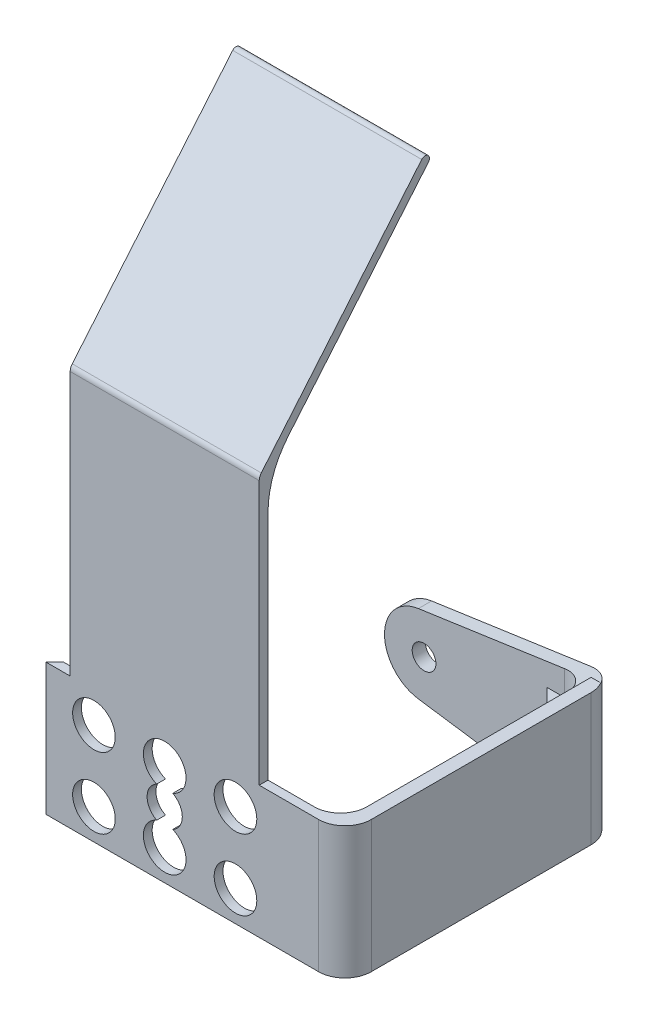
from build123d import *

# Parameters (mm, degrees)
SKETCH_1_W                  = 27
SKETCH_1_H                  = 15
EXTRUDE_1_DEPTH             = 1
SKETCH_2_R                  = 2.425
CUT_EXTRUDE_1_DEPTH         = 16.475787541
EXTRUDE_2_DEPTH             = 15
SKETCH_6_W                  = 1.5
SKETCH_6_H                  = 2
EXTRUDE_3_DEPTH             = 4
SKETCH_7_R                  = 1.35
CUT_EXTRUDE_3_DEPTH         = 1.5
FILLET_1_R                  = 3
CHAMFER_1_SIZE              = 1
CUT_EXTRUDE_4_REACH         = 39.101
SKETCH_8_R                  = 2
SKETCH_9_W                  = 21.5
SKETCH_9_H                  = 30
EXTRUDE_4_DEPTH             = 1
EXTRUDE_5_REACH             = 54.216
EXTRUDE_5_DIRECTION_2_REACH = 54.216
FILLET_2_R                  = 10
FILLET_3_R                  = 0.5


# Some blends are built 0.0001 mm under size
with BuildPart() as part:
    # 草图1 → 凸台-拉伸1 (new body)
    with BuildSketch(Plane.XY):
        Rectangle(SKETCH_1_W, SKETCH_1_H)
    extrude(amount=EXTRUDE_1_DEPTH)

    # 草图2 → 切除-拉伸1 (cut, through all)
    with BuildSketch(Plane.XY.offset(1)):
        with Locations((0, 4.025)):
            Circle(SKETCH_2_R)
        with Locations((0, -4.025)):
            Circle(SKETCH_2_R)
        with Locations((8.05, 4.025)):
            Circle(SKETCH_2_R)
        with Locations((8.05, -4.025)):
            Circle(SKETCH_2_R)
        with Locations((-8.05, 4.025)):
            Circle(SKETCH_2_R)
        with Locations((-8.05, -4.025)):
            Circle(SKETCH_2_R)
    extrude(amount=-CUT_EXTRUDE_1_DEPTH, mode=Mode.SUBTRACT)

    # 草图3 → 凸台-拉伸2 (add)
    with BuildSketch(Plane.XZ.offset(7.5)):
        Polygon((13.5, 0), (19, 0), (19, -28.5), (-4.5, -28.5), (-4.5, -30), (20.5, -30), (20.5, 1), (13.5, 1), align=None)
    extrude(amount=-EXTRUDE_2_DEPTH)

    # 草图6 → 凸台-拉伸3 (add, symmetric)
    with BuildSketch(Plane(origin=(0, 0, 0), x_dir=(1, 0, 0), z_dir=(0, 1, 0))):
        Polygon((19, 0), (19, 5), (14, 0), align=None)
        Polygon((19, 28.5), (14, 28.5), (19, 23.5), align=None)
        with Locations((18.25, 20)):
            Rectangle(SKETCH_6_W, SKETCH_6_H)
    extrude(amount=EXTRUDE_3_DEPTH, both=True)

    # 草图7 → 切除-拉伸3 (cut)
    with BuildSketch(Plane(origin=(0, 0, -30), x_dir=(-1, 0, 0), z_dir=(0, 0, -1))):
        with BuildLine():
            ThreePointArc((4.5, 0), (3.401301202, -2.946379157), (0.641711051, -4.454010207))
            Line((0.641711051, -4.454010207), (-20.5, -7.5))
            Line((-20.5, -7.5), (4.5, -7.5))
            Line((4.5, -7.5), (4.5, 0))
        make_face()
        with BuildLine():
            Line((-20.5, 7.5), (0.641711051, 4.454010207))
            ThreePointArc((0.641711051, 4.454010207), (3.401301202, 2.946379157), (4.5, 0))
            Line((4.5, 0), (4.5, 7.5))
            Line((4.5, 7.5), (-20.5, 7.5))
        make_face()
        Circle(SKETCH_7_R)
    extrude(amount=-CUT_EXTRUDE_3_DEPTH, mode=Mode.SUBTRACT)

    # 圆角1
    # the kernel refuses this fillet: 3 mm, written as the material it adds along each edge
    with BuildSketch(Plane(origin=(19, -3.5, -28.5), x_dir=(-1, 0, 0), z_dir=(0, 1, 0))) as fillet_1_piece_1_section:
        with BuildLine():
            CenterArc((FILLET_1_R, FILLET_1_R), FILLET_1_R, 180, 90)
            Line((0, FILLET_1_R), (0, 0))
            Line((0, 0), (FILLET_1_R, 0))
        make_face()
    fillet_1_piece_1 = extrude(amount=18.283887658, mode=Mode.PRIVATE)
    fillet_1_piece_1 = split(fillet_1_piece_1, bisect_by=Plane(origin=(18.119115161, 7.156974268, -27.821481802), z_dir=(0.1426024558755584, -0.9897800460598605, 0)), keep=Keep.TOP, mode=Mode.PRIVATE)
    add(fillet_1_piece_1)
    with BuildSketch(Plane(origin=(19, -3.5, 0), x_dir=(0, 0, -1), z_dir=(0, 1, 0)), Plane(origin=(19, -7.5, 0), x_dir=(0, 0, -1), z_dir=(0, 1, 0))) as fillet_1_piece_2:
        with BuildLine():
            CenterArc((FILLET_1_R, FILLET_1_R), FILLET_1_R, 180, 90)
            Line((0, FILLET_1_R), (0, 0))
            Line((0, 0), (FILLET_1_R, 0))
        make_face()
    extrude(amount=11)
    with BuildSketch(Plane(origin=(19, -14.783887658, -28.5), x_dir=(-1, 0, 0), z_dir=(0, 1, 0))) as fillet_1_piece_3_section:
        with BuildLine():
            CenterArc((FILLET_1_R, FILLET_1_R), FILLET_1_R, 180, 90)
            Line((0, FILLET_1_R), (0, 0))
            Line((0, 0), (FILLET_1_R, 0))
        make_face()
    fillet_1_piece_3 = extrude(amount=18.283887658, mode=Mode.PRIVATE)
    fillet_1_piece_3 = split(fillet_1_piece_3, bisect_by=Plane(origin=(18.119115161, -7.156974268, -27.821481802), z_dir=(0.1426024558755584, 0.9897800460598605, 0)), keep=Keep.TOP, mode=Mode.PRIVATE)
    add(fillet_1_piece_3)
    # the kernel refuses this fillet: 3 mm, written as the material it takes off along each edge
    with BuildSketch(Plane(origin=(20.5, -15, 1), x_dir=(0, 0, -1), z_dir=(0, 1, 0))) as fillet_1_2_piece_1:
        with BuildLine():
            CenterArc((FILLET_1_R, FILLET_1_R), FILLET_1_R, 180, 90)
            Line((0, FILLET_1_R), (0, 0))
            Line((0, 0), (FILLET_1_R, 0))
        make_face()
    extrude(amount=30, mode=Mode.SUBTRACT)
    with BuildSketch(Plane(origin=(20.5, -15, -30), x_dir=(0, 0, 1), z_dir=(0, 1, 0))) as fillet_1_2_piece_2:
        with BuildLine():
            CenterArc((FILLET_1_R, -FILLET_1_R), FILLET_1_R, 90, 90)
            Line((0, -FILLET_1_R), (0, 0))
            Line((0, 0), (FILLET_1_R, 0))
        make_face()
    extrude(amount=30, mode=Mode.SUBTRACT)

    # 倒角1
    chamfer_1_edges = [part.edges().sort_by_distance(p)[0] for p in [
        (-13.5, 0, 0),
    ]]
    chamfer(chamfer_1_edges, length=CHAMFER_1_SIZE - 0.0001)  # a hair under: the kernel refuses the full size

    # 草图8 → 切除-拉伸4 (cut, up to next)
    with BuildSketch(Plane(origin=(0, 0, 0), x_dir=(-1, 0, 0), z_dir=(0, 0, -1)), mode=Mode.PRIVATE) as cut_extrude_4_sk1:
        Circle(SKETCH_8_R)
    cut_extrude_4_tool1 = extrude(cut_extrude_4_sk1.sketch, amount=-CUT_EXTRUDE_4_REACH, mode=Mode.PRIVATE) & part.part
    add(cut_extrude_4_tool1.solids().sort_by_distance((0, 0, 0))[0], mode=Mode.SUBTRACT)

    # 草图9 → 凸台-拉伸4 (add)
    with BuildSketch(Plane.XY.offset(1)):
        with Locations((0, 22.5)):
            Rectangle(SKETCH_9_W, SKETCH_9_H)
    extrude(amount=-EXTRUDE_4_DEPTH)

    # 凸台-拉伸5: up to this face of the body (flat: up to its plane)
    extrude_5_end = Plane(part.part.faces().sort_by_distance((-10.75, 22.5, 0.5))[0])
    # 草图10 → 凸台-拉伸5 (add, up to the picked face)
    with BuildSketch(Plane(origin=(0, 0, 0), x_dir=(0, 0, -1), z_dir=(1, 0, 0)), mode=Mode.PRIVATE) as extrude_5_sk1:
        with BuildLine():
            Line((-1, 37.5), (0, 37.5))
            Line((0, 37.5), (18.572123903, 59.633395384))
            Line((18.572123903, 59.633395384), (17.80607946, 60.276182993))
            Line((17.80607946, 60.276182993), (-0.766044443, 38.14278761))
            ThreePointArc((-0.766044443, 38.14278761), (-0.939692621, 37.842020143), (-1, 37.5))
        make_face()
    extrude_5_tool1 = split(extrude(extrude_5_sk1.sketch, amount=-EXTRUDE_5_REACH, mode=Mode.PRIVATE), bisect_by=extrude_5_end, keep=Keep.BOTH, mode=Mode.PRIVATE)
    add(extrude_5_tool1.solids().sort_by(Axis((0, 48.754818, -8.789436), (-1, 0, 0)))[0])

    # 凸台-拉伸5 direction 2: up to this face of the body (flat: up to its plane)
    extrude_5_direction_2_end = Plane(part.part.faces().sort_by_distance((10.75, 22.5, 0.5))[0])
    # 草图10 → 凸台-拉伸5 direction 2 (add, up to the picked face)
    with BuildSketch(Plane(origin=(0, 0, 0), x_dir=(0, 0, -1), z_dir=(1, 0, 0)), mode=Mode.PRIVATE) as extrude_5_direction_2_sk1:
        with BuildLine():
            Line((-1, 37.5), (0, 37.5))
            Line((0, 37.5), (18.572123903, 59.633395384))
            Line((18.572123903, 59.633395384), (17.80607946, 60.276182993))
            Line((17.80607946, 60.276182993), (-0.766044443, 38.14278761))
            ThreePointArc((-0.766044443, 38.14278761), (-0.939692621, 37.842020143), (-1, 37.5))
        make_face()
    extrude_5_direction_2_tool1 = split(extrude(extrude_5_direction_2_sk1.sketch, amount=EXTRUDE_5_DIRECTION_2_REACH, mode=Mode.PRIVATE), bisect_by=extrude_5_direction_2_end, keep=Keep.BOTH, mode=Mode.PRIVATE)
    add(extrude_5_direction_2_tool1.solids().sort_by(Axis((0, 48.754818, -8.789436), (1, 0, 0)))[0])

    # 圆角2
    fillet_2_edges = [part.edges().sort_by_distance(p)[0] for p in [
        (0, 37.5, 0),
    ]]
    fillet(fillet_2_edges, radius=FILLET_2_R)

    # 圆角3
    fillet_3_edges = [part.edges().sort_by_distance(p)[0] for p in [
        (0, 60.276182993, -17.80607946),
        (0, 59.633395384, -18.572123903),
    ]]
    fillet(fillet_3_edges, radius=FILLET_3_R - 0.0001)  # a hair under: the kernel refuses the full size


solid = part.part
